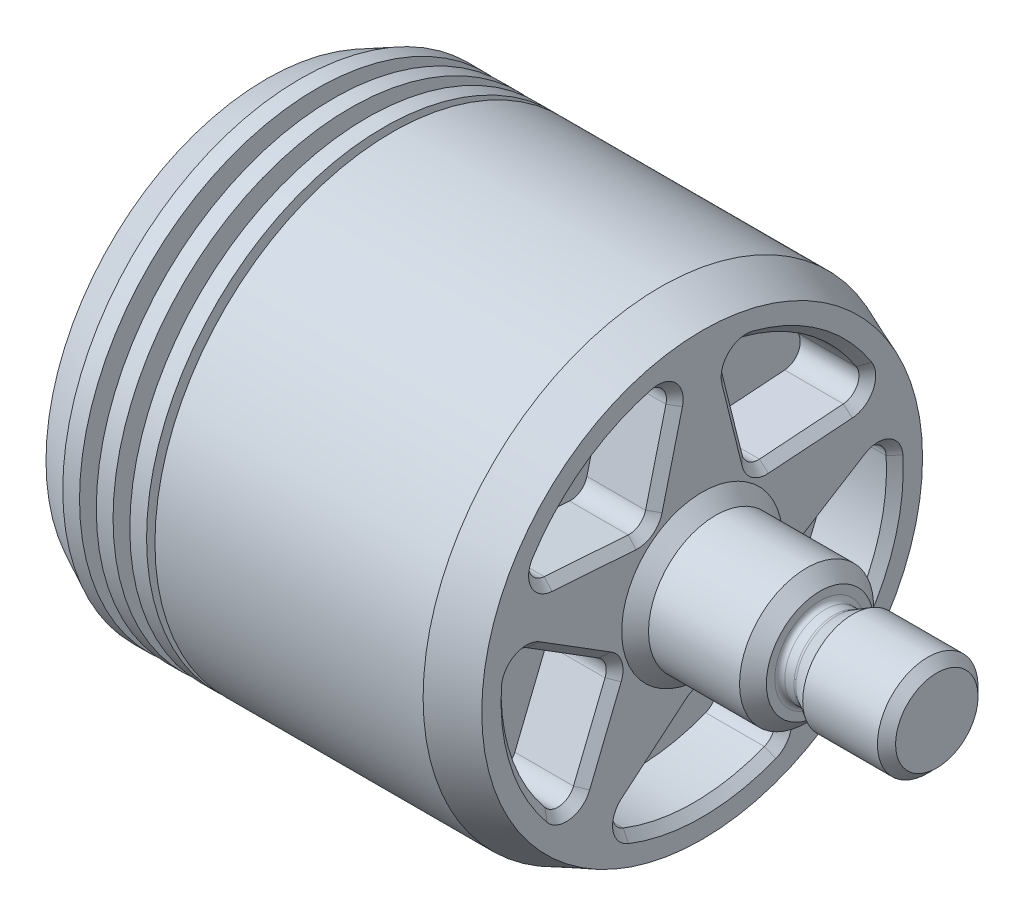
from build123d import *

# Parameters (mm, degrees)
SKETCH_1_R                       = 14.15
EXTRUDE_1_DEPTH                  = 26
SKETCH_2_R                       = 4
EXTRUDE_2_DEPTH                  = 14
CHAMFER1_SIZE                    = 0.8
HOLE_WIZARD_M3_1_D               = 2.5
HOLE_WIZARD_M3_1_DEPTH           = 8.5
HOLE_WIZARD_M3_1_TIP             = 0.751075774
CHAMFER_1_SIZE                   = 2.5
CHAMFER_1_SIZE2                  = 1
CUT_EXTRUDE_1_DEPTH              = 4
FILLET_1_R                       = 1
PATTERN_CIRCULAR_1_COUNT         = 5
FILLET_1_OF_PATTERN_CIRCULAR_1_R = 1
CHAMFER2_SIZE                    = 0.5
SKETCH2_W                        = 0.5
SKETCH2_H                        = 4.15
SKETCH2_W_2                      = 1
SKETCH2_H_2                      = 2.15
CHAMFER3_SIZE                    = 1
CHAMFER3_SIZE2                   = 2


# Read off the part's stored shape, not the designer's step: M6 Machine Threads Stud1
with BuildPart() as part:
    # 草图1 → 凸台-拉伸1 (new body)
    with BuildSketch(Plane(origin=(0, 0, 0), x_dir=(0, 0, -1), z_dir=(1, 0, 0))):
        with Locations(Location((0, 0, 0), (0, 0, 180))):
            Circle(SKETCH_1_R)
    extrude(amount=EXTRUDE_1_DEPTH)

    # 草图2 → 凸台-拉伸2 (add)
    with BuildSketch(Plane(origin=(26, 0, 0), x_dir=(0, 0, -1), z_dir=(1, 0, 0))):
        Circle(SKETCH_2_R)
    extrude(amount=EXTRUDE_2_DEPTH)

    # M6 Machine Threads Stud1 outline → M6 Machine Threads Stud1 (revolve, cut)
    with BuildSketch(Plane.YX):
        with BuildLine():
            Line((4, 40), (2.4585, 40))
            Line((2.4585, 40), (3, 39.4585))
            Line((3, 39.4585), (3, 35))
            Line((3, 35), (2.440192379, 34.030384758))
            ThreePointArc((2.440192379, 34.030384758), (2.410222252, 33.958030472), (2.4, 33.880384758))
            Line((2.4, 33.880384758), (2.4, 33.330384758))
            ThreePointArc((2.4, 33.330384758), (2.487867965, 33.118252723), (2.7, 33.030384758))
            Line((2.7, 33.030384758), (4, 33.030384758))
            Line((4, 33.030384758), (4, 40))
        make_face()
    revolve(axis=Axis((0, 0, 0), (1, 0, 0)), mode=Mode.SUBTRACT)

    # Chamfer1
    chamfer1_edges = [part.edges().sort_by_distance(p)[0] for p in [
        (33.030384758, 0, 4),
        (26, 0, 4),
    ]]
    chamfer(chamfer1_edges, length=CHAMFER1_SIZE)

    # M3 螺纹孔1
    with Locations(Plane.ZY):
        with Locations((8, 0), (0, 9.5), (0, -9.5), (-8, 0)):
            Hole(HOLE_WIZARD_M3_1_D / 2, depth=HOLE_WIZARD_M3_1_DEPTH)
            with Locations((0, 0, -(HOLE_WIZARD_M3_1_DEPTH + HOLE_WIZARD_M3_1_TIP / 2))):  # 118° drill point
                Cone(0, HOLE_WIZARD_M3_1_D / 2, HOLE_WIZARD_M3_1_TIP, mode=Mode.SUBTRACT)

    # 倒角1
    chamfer_1_edges = [part.edges().sort_by_distance(p)[0] for p in [
        (26, 0, -14.15),
    ]]
    chamfer_1_side = [part.faces().sort_by_distance(p)[0] for p in [
        (13, 0, -14.15),
    ]]
    chamfer(chamfer_1_edges, length=CHAMFER_1_SIZE, length2=CHAMFER_1_SIZE2, reference=chamfer_1_side[0])

    # 草图8 → 切除-拉伸1 (cut)
    with BuildSketch(Plane(origin=(26, 0, 0), x_dir=(0, 0, -1), z_dir=(1, 0, 0))):
        with BuildLine():
            Line((0, -5.238373922), (-5.676389324, -10.00143011))
            ThreePointArc((-5.676389324, -10.00143011), (0, -11.5), (5.676389324, -10.00143011))
            Line((5.676389324, -10.00143011), (0, -5.238373922))
        make_face()
    cut_extrude_1 = extrude(amount=-CUT_EXTRUDE_1_DEPTH, mode=Mode.SUBTRACT)

    # 圆角1
    fillet_1_edges = [part.edges().sort_by_distance(p)[0] for p in [
        (24, -10.00143011, 5.676389324),
        (24, -5.238373922, 0),
        (24, -10.00143011, -5.676389324),
    ]]
    fillet(fillet_1_edges, radius=FILLET_1_R)

    # 阵列(圆周)1: 切除-拉伸1 ×5 about axis
    pattern_circular_1_axis = Axis((0, 0, 0), (1, 0, 0))
    for i in range(1, PATTERN_CIRCULAR_1_COUNT):
        add(cut_extrude_1.rotate(pattern_circular_1_axis, i * 360 / PATTERN_CIRCULAR_1_COUNT), mode=Mode.SUBTRACT)

    # 圆角1 of 阵列(圆周)1
    fillet_1_of_pattern_circular_1_edges = [part.edges().sort_by_distance(p)[0] for p in [
        (24, -8.489178927, -7.757824511),
        (24, -1.618746565, -4.981989654),
        (24, 2.307955183, -11.266026046),
        (24, 4.754828997, -10.47098855),
        (24, 4.237933526, -3.079038938),
        (24, 11.427824858, -1.286397691),
        (24, 11.427824858, 1.286397691),
        (24, 4.237933526, 3.079038938),
        (24, 4.754828997, 10.47098855),
        (24, 2.307955183, 11.266026046),
        (24, -1.618746565, 4.981989654),
        (24, -8.489178927, 7.757824511),
    ]]
    fillet(fillet_1_of_pattern_circular_1_edges, radius=FILLET_1_OF_PATTERN_CIRCULAR_1_R)

    # Chamfer2
    chamfer2_edges = [part.edges().sort_by_distance(p)[0] for p in [
        (26, 0.155972278, 7.822133498),
        (26, -4.723918935, 6.236560727),
        (26, -3.553695435, 10.937149937),
        (26, -1.713122608, 5.272449246),
        (26, 1.526939092, 10.938601831),
        (26, -7.664868512, 7.952002496),
        (26, 7.487489119, 2.268833731),
        (26, 4.471550488, 6.419917137),
        (26, 9.303695435, 6.759530401),
        (26, 4.485013213, 3.258552838),
        (26, 10.875078679, 1.928008487),
        (26, 5.194229162, 9.747027055),
        (26, 4.471550488, -6.419917137),
        (26, 7.487489119, -2.268833731),
        (26, 9.303695435, -6.759530401),
        (26, 4.485013213, -3.258552838),
        (26, 5.194229162, -9.747027055),
        (26, 10.875078679, -1.928008487),
        (26, -4.723918935, -6.236560727),
        (26, 0.155972278, -7.822133498),
        (26, -3.553695435, -10.937149937),
        (26, -1.713122608, -5.272449246),
        (26, -7.664868512, -7.952002496),
        (26, 1.526939092, -10.938601831),
        (26, -7.39109295, 2.565510635),
        (26, -7.39109295, -2.565510635),
        (26, -11.5, 0),
        (26, -5.543781212, 0),
        (26, -9.931378421, 4.832419234),
        (26, -9.931378421, -4.832419234),
    ]]
    chamfer(chamfer2_edges, length=CHAMFER2_SIZE)

    # Sketch2 → Cut-Revolve1 (revolve, cut)
    with BuildSketch(Plane.XY, mode=Mode.PRIVATE) as cut_revolve1_sk:
        with Locations((7.25, 12.075)):
            Rectangle(SKETCH2_W, SKETCH2_H)
        with Locations((3.5, 13.075)):
            Rectangle(SKETCH2_W_2, SKETCH2_H_2)
        with Locations((5.5, 13.075)):
            Rectangle(SKETCH2_W_2, SKETCH2_H_2)
    revolve(cut_revolve1_sk.sketch.rotate(Axis((0, 0, 0), (1, 0, 0)), 90), axis=Axis((0, 0, 0), (1, 0, 0)), mode=Mode.SUBTRACT)

    # Chamfer3
    chamfer3_edges = [part.edges().sort_by_distance(p)[0] for p in [
        (0, 0, -14.15),
    ]]
    chamfer3_side = [part.faces().sort_by_distance(p)[0] for p in [
        (0, 0, 0),
    ]]
    chamfer(chamfer3_edges, length=CHAMFER3_SIZE, length2=CHAMFER3_SIZE2, reference=chamfer3_side[0])


solid = part.part
